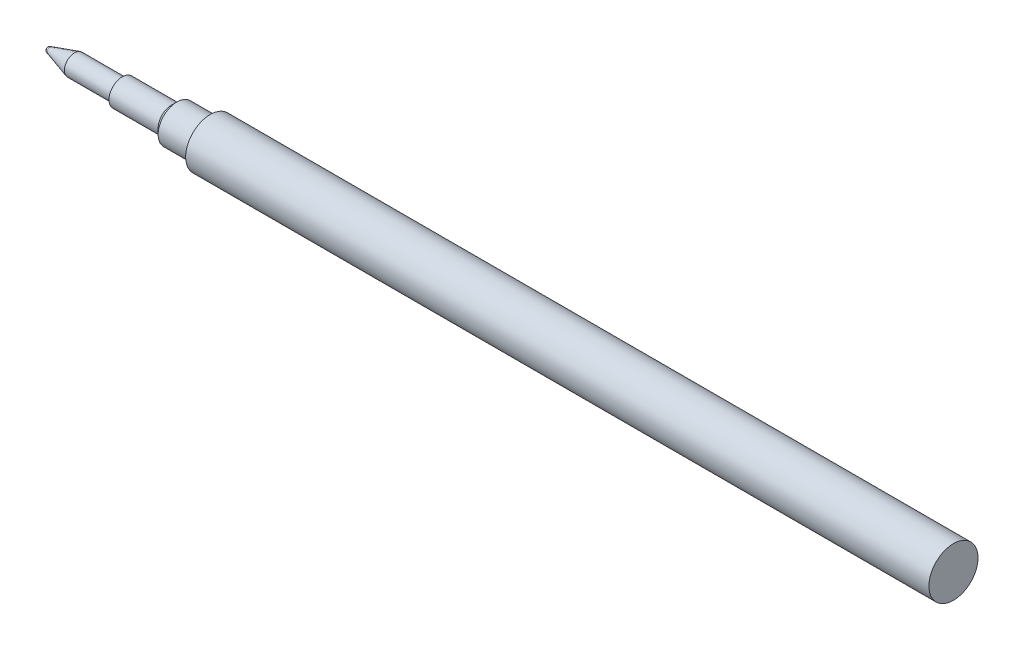
from build123d import *


with BuildPart() as part:
    # Sketch1 → Revolve1 (revolve)
    with BuildSketch(Plane.XY):
        with BuildLine():
            Line((-90.77, 3), (-90.77, 2.3))
            Line((-90.77, 2.3), (-94.83, 2.3))
            Line((-94.83, 2.3), (-95.51, 1.62))
            Line((-95.51, 1.62), (-101.51, 1.62))
            Line((-101.51, 1.62), (-101.51, 1.25))
            Line((-101.51, 1.25), (-107.33, 1.25))
            Line((-107.33, 1.25), (-110.33, 0.35))
            ThreePointArc((-110.33, 0.35), (-110.577487373, 0.247487373), (-110.68, 0))
            Line((-110.68, 0), (0, 0))
            Line((0, 0), (0, 3))
            Line((0, 3), (-90.77, 3))
        make_face()
    revolve(axis=Axis((0, 0, 0), (-1, 0, 0)))


solid = part.part
